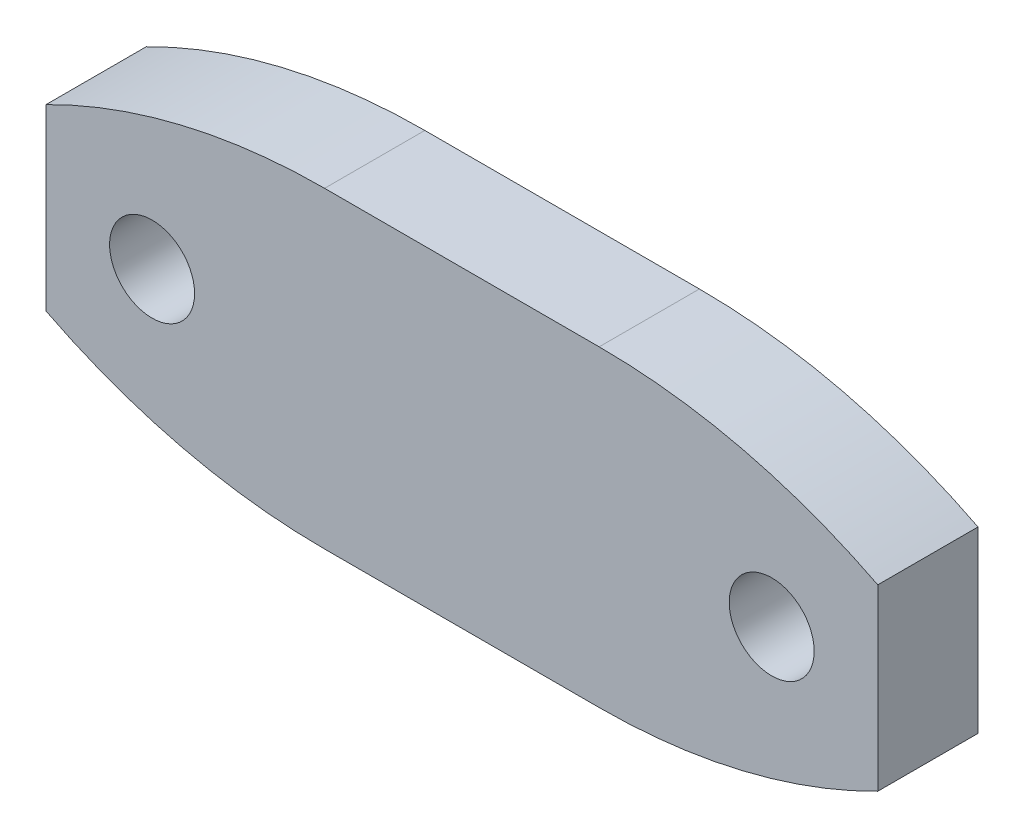
from build123d import *

# Parameters (mm, degrees)
SKETCH1_W                = 63.9
SKETCH1_H                = 24
BOSS_EXTRUDE1_DEPTH      = 7.7
F_5_16_18_TAPPED_HOLE1_D = 6.5278
CUT_EXTRUDE1_DEPTH       = 69.69133861


with BuildPart() as part:
    # Sketch1 → Boss-Extrude1 (new body)
    with BuildSketch(Plane.XY):
        with Locations((31.95, 12)):
            Rectangle(SKETCH1_W, SKETCH1_H)
    extrude(amount=BOSS_EXTRUDE1_DEPTH)

    # 5/16-18 Tapped Hole1 (through all)
    with Locations(Plane(origin=(8.15, 12, 7.7), x_dir=(1, 0, 0), z_dir=(0, 0, 1))):
        with Locations((0, 0), (47.6, 0)):
            Hole(F_5_16_18_TAPPED_HOLE1_D / 2)

    # Sketch4 → Cut-Extrude1 (cut, through all)
    with BuildSketch(Plane.XY.offset(7.7)):
        with BuildLine():
            Line((63.9, 18.867585454), (63.9, 24))
            Line((63.9, 24), (42.497091947, 24))
            ThreePointArc((42.497091947, 24), (53.50193352, 22.698962504), (63.9, 18.867585454))
        make_face()
        with BuildLine():
            Line((63.9, 0), (63.9, 5.132414546))
            ThreePointArc((63.9, 5.132414546), (53.50193352, 1.301037496), (42.497091947, 0))
            Line((42.497091947, 0), (63.9, 0))
        make_face()
        with BuildLine():
            ThreePointArc((0, 18.867585454), (10.39806648, 22.698962504), (21.402908053, 24))
            Line((21.402908053, 24), (0, 24))
            Line((0, 24), (0, 18.867585454))
        make_face()
        with BuildLine():
            Line((0, 0), (21.402908053, 0))
            ThreePointArc((21.402908053, 0), (10.39806648, 1.301037496), (0, 5.132414546))
            Line((0, 5.132414546), (0, 0))
        make_face()
    extrude(amount=-CUT_EXTRUDE1_DEPTH, mode=Mode.SUBTRACT)


solid = part.part
